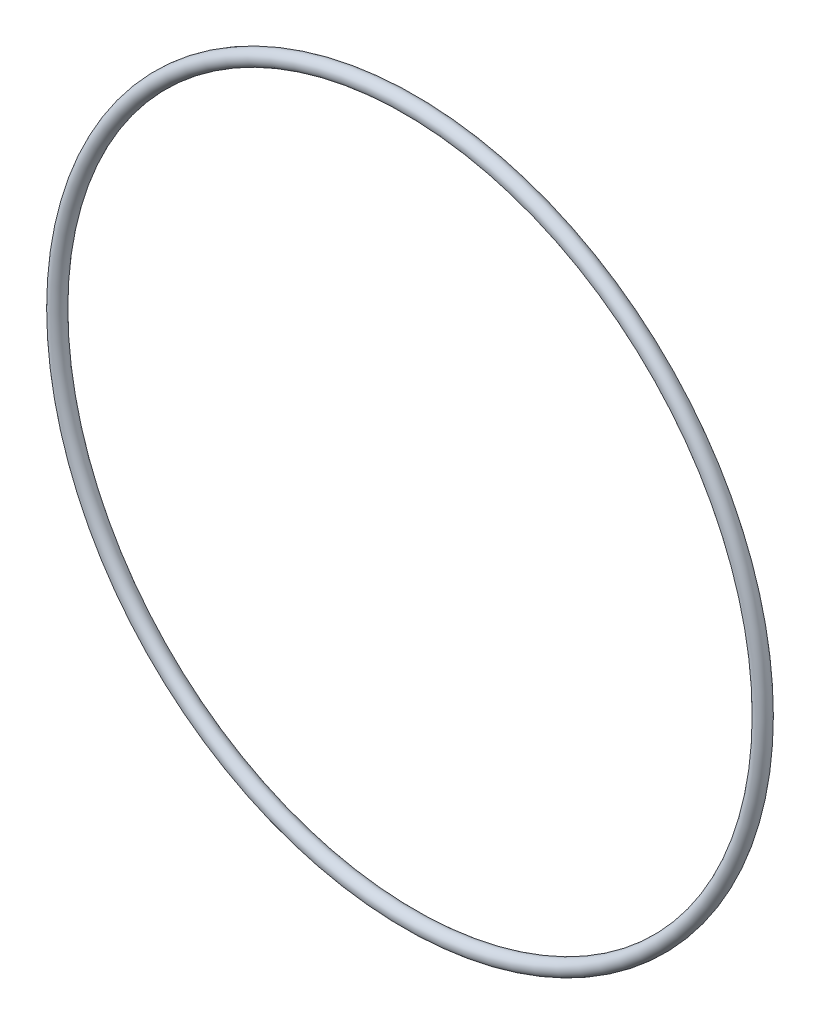
from build123d import *

# Parameters (mm, degrees)
SKETCH3_R = 1.3081


with BuildPart() as part:
    # Sketch3 → Revolve1 (revolve)
    with BuildSketch(Plane(origin=(0, 0, 0), x_dir=(0, 0, -1), z_dir=(1, 0, 0))):
        with Locations((0, -61.468)):
            Circle(SKETCH3_R)
    revolve(axis=Axis((0, 0, -1.3081), (0, 0, 1)))


solid = part.part
